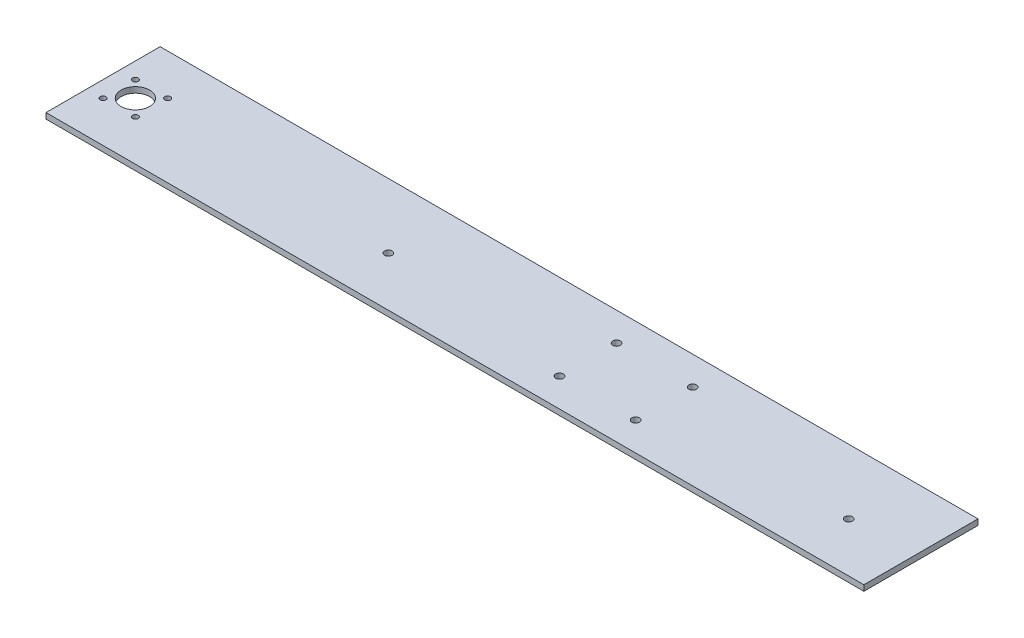
from build123d import *

# Parameters (mm, degrees)
SKETCH1_W                 = 430
SKETCH1_H                 = 60
BOSS_EXTRUDE1_DEPTH       = 3
OTW_R_POD_RUB_M41_D       = 4
SKETCH4_R                 = 7.5
CUT_EXTRUDE1_DEPTH        = 5
F_3_0MM_DOWEL_HOLE1_D     = 3
F_3_0MM_DOWEL_HOLE1_DEPTH = 6
F_3_0MM_DOWEL_HOLE1_TIP   = 0.901290929


with BuildPart() as part:
    # Sketch1 → Boss-Extrude1 (new body)
    with BuildSketch(Plane(origin=(0, 0, 0), x_dir=(1, 0, 0), z_dir=(0, 1, 0))):
        with Locations((85, 30)):
            Rectangle(SKETCH1_W, SKETCH1_H)
    extrude(amount=BOSS_EXTRUDE1_DEPTH)

    # Otwór pod śrubę M41 (through all)
    with Locations(Plane(origin=(0, 3, 0), x_dir=(1, 0, 0), z_dir=(0, 1, 0))):
        with Locations((266, 26), (24, 26), (125, 15), (165, 15), (165, 45), (125, 45)):
            Hole(OTW_R_POD_RUB_M41_D / 2)

    # Sketch4 → Cut-Extrude1 (cut)
    with BuildSketch(Plane(origin=(0, 3, 0), x_dir=(1, 0, 0), z_dir=(0, 1, 0))):
        with Locations((-113, 30)):
            Circle(SKETCH4_R)
    extrude(amount=-CUT_EXTRUDE1_DEPTH, mode=Mode.SUBTRACT)

    # Ø3.0mm Dowel Hole1
    with Locations(Plane(origin=(0, 3, 0), x_dir=(1, 0, 0), z_dir=(0, 1, 0))):
        with Locations((-121.485281374, 21.514718626), (-121.485281374, 38.485281374), (-104.514718626, 21.514718626), (-104.514718626, 38.485281374)):
            Hole(F_3_0MM_DOWEL_HOLE1_D / 2, depth=F_3_0MM_DOWEL_HOLE1_DEPTH)
            with Locations((0, 0, -(F_3_0MM_DOWEL_HOLE1_DEPTH + F_3_0MM_DOWEL_HOLE1_TIP / 2))):  # 118° drill point
                Cone(0, F_3_0MM_DOWEL_HOLE1_D / 2, F_3_0MM_DOWEL_HOLE1_TIP, mode=Mode.SUBTRACT)


solid = part.part
